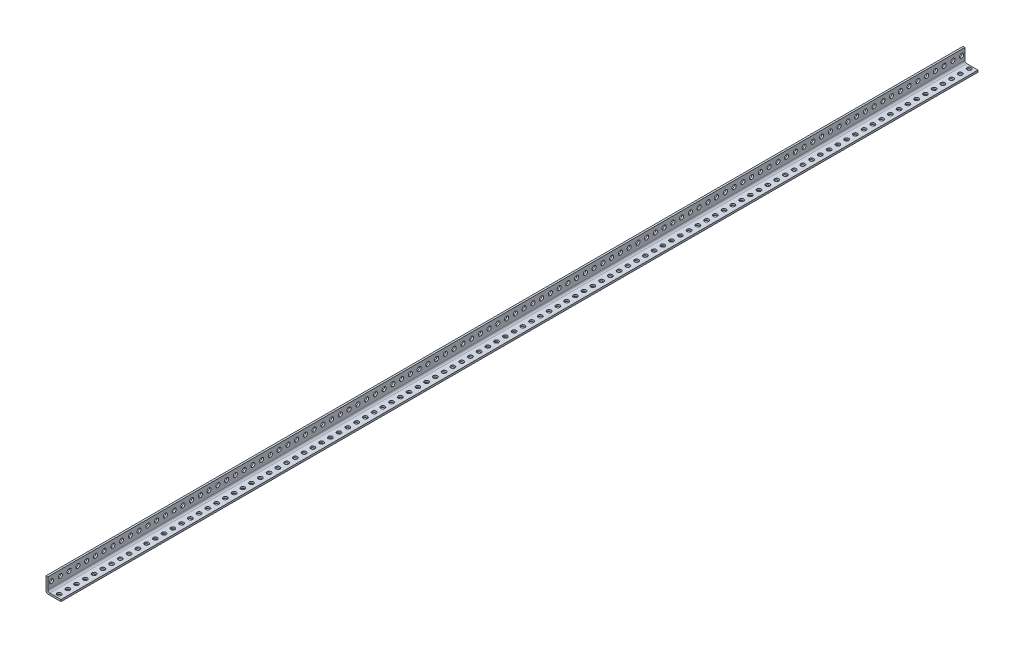
from build123d import *

# Parameters (mm, degrees)
BOSS_EXTRUDE1_DEPTH = 1555.75
SKETCH2_R           = 3.4925
FILLET1_R           = 3.175


with BuildPart() as part:
    # Sketch1 → Boss-Extrude1 (new body)
    with BuildSketch(Plane.XY):
        Polygon((0, 3.175), (0, 25.4), (3.175, 25.4), (3.175, 6.35), (3.175, 3.175), (6.35, 3.175), (25.4, 3.175), (25.4, 0), (3.175, 0), (0, 0), align=None)
    extrude(amount=BOSS_EXTRUDE1_DEPTH)

    # Sketch2 → Cut-Revolve1 (revolve, cut)
    with BuildSketch(Plane(origin=(0, 3.175, 0), x_dir=(1, 0, 0), z_dir=(0, 1, 0))):
        with Locations((15.875, -1549.4)):
            Circle(SKETCH2_R)
        with Locations((15.875, -1534.555224)):
            Circle(SKETCH2_R)
        with Locations((15.875, -1519.710448)):
            Circle(SKETCH2_R)
        with Locations((15.875, -1504.865672)):
            Circle(SKETCH2_R)
        with Locations((15.875, -1490.020896)):
            Circle(SKETCH2_R)
        with Locations((15.875, -1475.17612)):
            Circle(SKETCH2_R)
        with Locations((15.875, -1460.331344)):
            Circle(SKETCH2_R)
        with Locations((15.875, -1445.486568)):
            Circle(SKETCH2_R)
        with Locations((15.875, -1430.641792)):
            Circle(SKETCH2_R)
        with Locations((15.875, -1415.797016)):
            Circle(SKETCH2_R)
        with Locations((15.875, -1400.95224)):
            Circle(SKETCH2_R)
        with Locations((15.875, -1386.107464)):
            Circle(SKETCH2_R)
        with Locations((15.875, -1371.262688)):
            Circle(SKETCH2_R)
        with Locations((15.875, -1356.417912)):
            Circle(SKETCH2_R)
        with Locations((15.875, -1341.573136)):
            Circle(SKETCH2_R)
        with Locations((15.875, -1326.72836)):
            Circle(SKETCH2_R)
        with Locations((15.875, -1311.883584)):
            Circle(SKETCH2_R)
        with Locations((15.875, -1297.038808)):
            Circle(SKETCH2_R)
        with Locations((15.875, -1282.194032)):
            Circle(SKETCH2_R)
        with Locations((15.875, -1267.349256)):
            Circle(SKETCH2_R)
        with Locations((15.875, -1252.50448)):
            Circle(SKETCH2_R)
        with Locations((15.875, -1237.659704)):
            Circle(SKETCH2_R)
        with Locations((15.875, -1222.814928)):
            Circle(SKETCH2_R)
        with Locations((15.875, -1207.970152)):
            Circle(SKETCH2_R)
        with Locations((15.875, -1193.125376)):
            Circle(SKETCH2_R)
        with Locations((15.875, -1178.2806)):
            Circle(SKETCH2_R)
        with Locations((15.875, -1163.435824)):
            Circle(SKETCH2_R)
        with Locations((15.875, -1148.591048)):
            Circle(SKETCH2_R)
        with Locations((15.875, -1133.746272)):
            Circle(SKETCH2_R)
        with Locations((15.875, -1118.901496)):
            Circle(SKETCH2_R)
        with Locations((15.875, -1104.05672)):
            Circle(SKETCH2_R)
        with Locations((15.875, -1089.211944)):
            Circle(SKETCH2_R)
        with Locations((15.875, -1074.367168)):
            Circle(SKETCH2_R)
        with Locations((15.875, -1059.522392)):
            Circle(SKETCH2_R)
        with Locations((15.875, -1044.677616)):
            Circle(SKETCH2_R)
        with Locations((15.875, -1029.83284)):
            Circle(SKETCH2_R)
        with Locations((15.875, -1014.988064)):
            Circle(SKETCH2_R)
        with Locations((15.875, -1000.143288)):
            Circle(SKETCH2_R)
        with Locations((15.875, -985.298512)):
            Circle(SKETCH2_R)
        with Locations((15.875, -970.453736)):
            Circle(SKETCH2_R)
        with Locations((15.875, -955.60896)):
            Circle(SKETCH2_R)
        with Locations((15.875, -940.764184)):
            Circle(SKETCH2_R)
        with Locations((15.875, -925.919408)):
            Circle(SKETCH2_R)
        with Locations((15.875, -911.074632)):
            Circle(SKETCH2_R)
        with Locations((15.875, -896.229856)):
            Circle(SKETCH2_R)
        with Locations((15.875, -881.38508)):
            Circle(SKETCH2_R)
        with Locations((15.875, -866.540304)):
            Circle(SKETCH2_R)
        with Locations((15.875, -851.695528)):
            Circle(SKETCH2_R)
        with Locations((15.875, -836.850752)):
            Circle(SKETCH2_R)
        with Locations((15.875, -822.005976)):
            Circle(SKETCH2_R)
        with Locations((15.875, -807.1612)):
            Circle(SKETCH2_R)
        with Locations((15.875, -792.316424)):
            Circle(SKETCH2_R)
        with Locations((15.875, -777.471648)):
            Circle(SKETCH2_R)
        with Locations((15.875, -762.626872)):
            Circle(SKETCH2_R)
        with Locations((15.875, -747.782096)):
            Circle(SKETCH2_R)
        with Locations((15.875, -732.93732)):
            Circle(SKETCH2_R)
        with Locations((15.875, -718.092544)):
            Circle(SKETCH2_R)
        with Locations((15.875, -703.247768)):
            Circle(SKETCH2_R)
        with Locations((15.875, -688.402992)):
            Circle(SKETCH2_R)
        with Locations((15.875, -673.558216)):
            Circle(SKETCH2_R)
        with Locations((15.875, -658.71344)):
            Circle(SKETCH2_R)
        with Locations((15.875, -643.868664)):
            Circle(SKETCH2_R)
        with Locations((15.875, -629.023888)):
            Circle(SKETCH2_R)
        with Locations((15.875, -614.179112)):
            Circle(SKETCH2_R)
        with Locations((15.875, -599.334336)):
            Circle(SKETCH2_R)
        with Locations((15.875, -584.48956)):
            Circle(SKETCH2_R)
        with Locations((15.875, -569.644784)):
            Circle(SKETCH2_R)
        with Locations((15.875, -554.800008)):
            Circle(SKETCH2_R)
        with Locations((15.875, -539.955232)):
            Circle(SKETCH2_R)
        with Locations((15.875, -525.110456)):
            Circle(SKETCH2_R)
        with Locations((15.875, -510.26568)):
            Circle(SKETCH2_R)
        with Locations((15.875, -495.420904)):
            Circle(SKETCH2_R)
        with Locations((15.875, -480.576128)):
            Circle(SKETCH2_R)
        with Locations((15.875, -465.731352)):
            Circle(SKETCH2_R)
        with Locations((15.875, -450.886576)):
            Circle(SKETCH2_R)
        with Locations((15.875, -436.0418)):
            Circle(SKETCH2_R)
        with Locations((15.875, -421.197024)):
            Circle(SKETCH2_R)
        with Locations((15.875, -406.352248)):
            Circle(SKETCH2_R)
        with Locations((15.875, -391.507472)):
            Circle(SKETCH2_R)
        with Locations((15.875, -376.662696)):
            Circle(SKETCH2_R)
        with Locations((15.875, -361.81792)):
            Circle(SKETCH2_R)
        with Locations((15.875, -346.973144)):
            Circle(SKETCH2_R)
        with Locations((15.875, -332.128368)):
            Circle(SKETCH2_R)
        with Locations((15.875, -317.283592)):
            Circle(SKETCH2_R)
        with Locations((15.875, -302.438816)):
            Circle(SKETCH2_R)
        with Locations((15.875, -287.59404)):
            Circle(SKETCH2_R)
        with Locations((15.875, -272.749264)):
            Circle(SKETCH2_R)
        with Locations((15.875, -257.904488)):
            Circle(SKETCH2_R)
        with Locations((15.875, -243.059712)):
            Circle(SKETCH2_R)
        with Locations((15.875, -228.214936)):
            Circle(SKETCH2_R)
        with Locations((15.875, -213.37016)):
            Circle(SKETCH2_R)
        with Locations((15.875, -198.525384)):
            Circle(SKETCH2_R)
        with Locations((15.875, -183.680608)):
            Circle(SKETCH2_R)
        with Locations((15.875, -168.835832)):
            Circle(SKETCH2_R)
        with Locations((15.875, -153.991056)):
            Circle(SKETCH2_R)
        with Locations((15.875, -139.14628)):
            Circle(SKETCH2_R)
        with Locations((15.875, -124.301504)):
            Circle(SKETCH2_R)
        with Locations((15.875, -109.456728)):
            Circle(SKETCH2_R)
        with Locations((15.875, -94.611952)):
            Circle(SKETCH2_R)
        with Locations((15.875, -79.767176)):
            Circle(SKETCH2_R)
        with Locations((15.875, -64.9224)):
            Circle(SKETCH2_R)
        with Locations((15.875, -50.077624)):
            Circle(SKETCH2_R)
        with Locations((15.875, -35.232848)):
            Circle(SKETCH2_R)
        with Locations((15.875, -20.388072)):
            Circle(SKETCH2_R)
        with Locations((15.875, -5.543296)):
            Circle(SKETCH2_R)
    revolve(axis=Axis((3.175, 3.175, 1555.75), (0, 0, -1)), mode=Mode.SUBTRACT)

    # Fillet1
    fillet1_edges = [part.edges().sort_by_distance(p)[0] for p in [
        (3.175, 3.175, 777.875),
        (0, 0, 777.875),
    ]]
    fillet(fillet1_edges, radius=FILLET1_R)


solid = part.part
